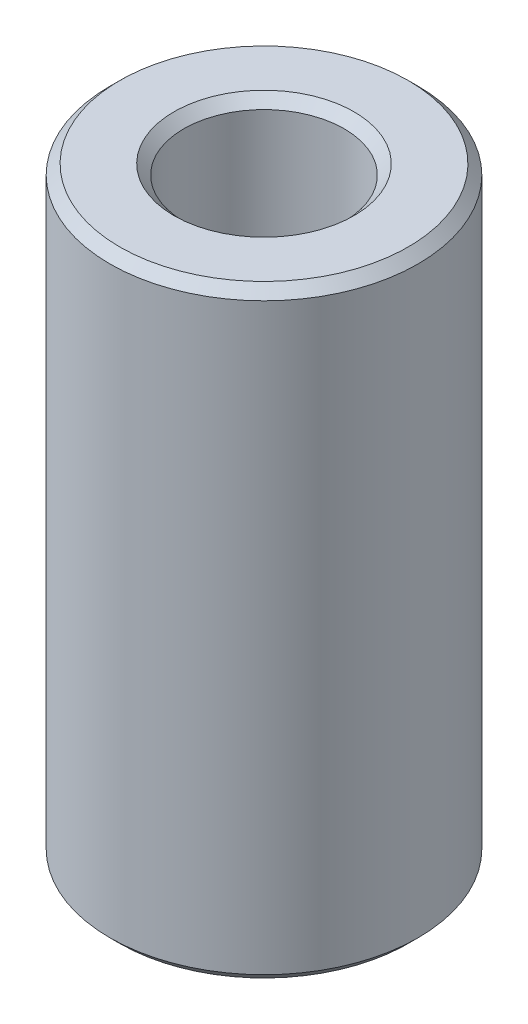
from build123d import *

# Parameters (mm, degrees)
SKETCH1_R           = 5
BOSS_EXTRUDE1_DEPTH = 19.580759276
SKETCH2_R           = 2.6040166
CUT_EXTRUDE1_DEPTH  = 21.818408533
CHAMFER1_SIZE       = 0.318690691


with BuildPart() as part:
    # Sketch1 → Boss-Extrude1 (new body)
    with BuildSketch(Plane(origin=(0, 0, 0), x_dir=(1, 0, 0), z_dir=(0, 1, 0))):
        Circle(SKETCH1_R)
    extrude(amount=BOSS_EXTRUDE1_DEPTH)

    # Sketch2 → Cut-Extrude1 (cut, through all)
    with BuildSketch(Plane(origin=(0, 0, 0), x_dir=(1, 0, 0), z_dir=(0, 1, 0))):
        Circle(SKETCH2_R)
    extrude(amount=CUT_EXTRUDE1_DEPTH, mode=Mode.SUBTRACT)

    # Chamfer1
    chamfer1_edges = [part.edges().sort_by_distance(p)[0] for p in [
        (-2.6040166, 19.580759276, 0),
        (-2.6040166, 0, 0),
        (-5, 0, 0),
        (-5, 19.580759276, 0),
    ]]
    chamfer(chamfer1_edges, length=CHAMFER1_SIZE)


solid = part.part
